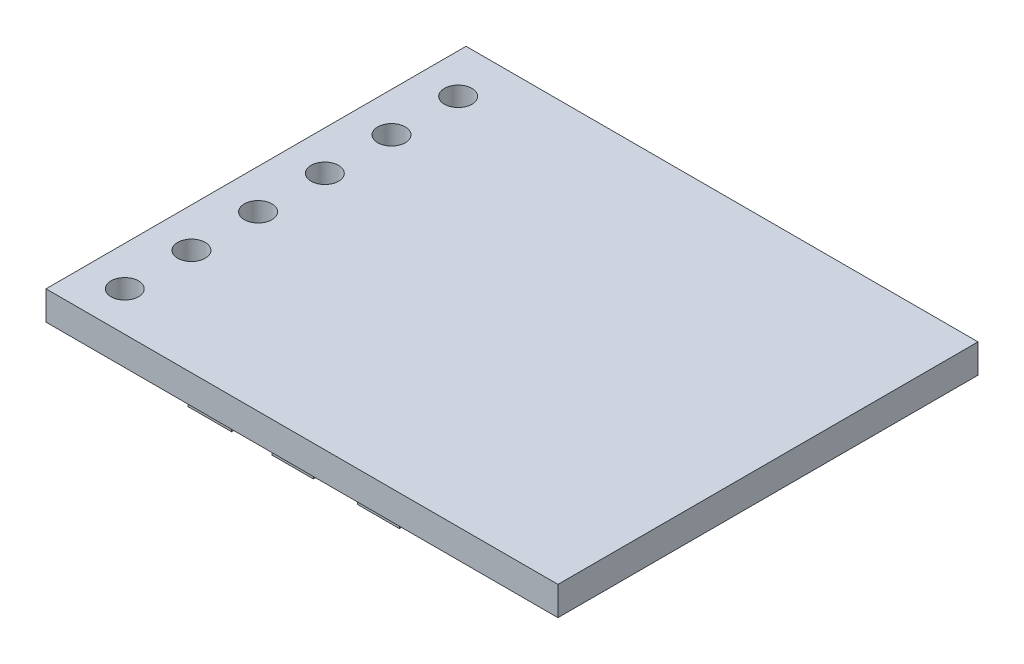
from build123d import *

# Parameters (mm, degrees)
SKETCH1_W               = 19.5
SKETCH1_H               = 16
PCB_DEPTH               = 1.1
HOLES_REACH             = 14.66
SKETCH2_R               = 0.525
SKETCH3_W               = 6.970626183
SKETCH3_H               = 7.047226471
SKETCH3_W_2             = 3.232532143
SKETCH3_H_2             = 1.853726963
SKETCH3_W_3             = 1.608606043
SKETCH3_H_3             = 0.674082532
SKETCH3_H_4             = 0.766002877
SKETCH3_W_4             = 3.140611797
SKETCH3_H_5             = 1.470725524
SKETCH3_W_5             = 0.949843568
SKETCH3_H_6             = 1.363485122
SKETCH3_W_6             = 0.919203453
SKETCH3_W_7             = 1.593285985
SKETCH3_H_7             = 0.827283108
SKETCH3_W_8             = 1.577965927
SKETCH3_W_9             = 1.669886272
SKETCH3_W_10            = 1.041763914
SKETCH3_H_8             = 1.516685697
SKETCH3_W_11            = 0.93452351
BOTTOM_COMPONENTS_DEPTH = 1.05


with BuildPart() as part:
    # Sketch1 → PCB (new body)
    with BuildSketch(Plane(origin=(0, 0, 0), x_dir=(1, 0, 0), z_dir=(0, 1, 0))):
        Rectangle(SKETCH1_W, SKETCH1_H)
    extrude(amount=PCB_DEPTH)

    # Sketch2 → Holes (cut, up to next)
    with BuildSketch(Plane(origin=(0, 1.1, 0), x_dir=(1, 0, 0), z_dir=(0, 1, 0)), mode=Mode.PRIVATE) as holes_sk1:
        with Locations((-8.25, -6.5)):
            Circle(SKETCH2_R)
    holes_tool1 = extrude(holes_sk1.sketch, amount=-HOLES_REACH, mode=Mode.PRIVATE) & part.part
    # Sketch2 → Holes (cut, up to next)
    with BuildSketch(Plane(origin=(0, 1.1, 0), x_dir=(1, 0, 0), z_dir=(0, 1, 0)), mode=Mode.PRIVATE) as holes_sk2:
        with Locations((-8.25, -3.96)):
            Circle(SKETCH2_R)
    holes_tool2 = extrude(holes_sk2.sketch, amount=-HOLES_REACH, mode=Mode.PRIVATE) & part.part
    # Sketch2 → Holes (cut, up to next)
    with BuildSketch(Plane(origin=(0, 1.1, 0), x_dir=(1, 0, 0), z_dir=(0, 1, 0)), mode=Mode.PRIVATE) as holes_sk3:
        with Locations((-8.25, -1.42)):
            Circle(SKETCH2_R)
    holes_tool3 = extrude(holes_sk3.sketch, amount=-HOLES_REACH, mode=Mode.PRIVATE) & part.part
    # Sketch2 → Holes (cut, up to next)
    with BuildSketch(Plane(origin=(0, 1.1, 0), x_dir=(1, 0, 0), z_dir=(0, 1, 0)), mode=Mode.PRIVATE) as holes_sk4:
        with Locations((-8.25, 1.12)):
            Circle(SKETCH2_R)
    holes_tool4 = extrude(holes_sk4.sketch, amount=-HOLES_REACH, mode=Mode.PRIVATE) & part.part
    # Sketch2 → Holes (cut, up to next)
    with BuildSketch(Plane(origin=(0, 1.1, 0), x_dir=(1, 0, 0), z_dir=(0, 1, 0)), mode=Mode.PRIVATE) as holes_sk5:
        with Locations((-8.25, 3.66)):
            Circle(SKETCH2_R)
    holes_tool5 = extrude(holes_sk5.sketch, amount=-HOLES_REACH, mode=Mode.PRIVATE) & part.part
    # Sketch2 → Holes (cut, up to next)
    with BuildSketch(Plane(origin=(0, 1.1, 0), x_dir=(1, 0, 0), z_dir=(0, 1, 0)), mode=Mode.PRIVATE) as holes_sk6:
        with Locations((-8.25, 6.2)):
            Circle(SKETCH2_R)
    holes_tool6 = extrude(holes_sk6.sketch, amount=-HOLES_REACH, mode=Mode.PRIVATE) & part.part
    add(holes_tool1.solids().sort_by_distance((-8.25, 1.1, 6.5))[0], mode=Mode.SUBTRACT)
    add(holes_tool2.solids().sort_by_distance((-8.25, 1.1, 3.96))[0], mode=Mode.SUBTRACT)
    add(holes_tool3.solids().sort_by_distance((-8.25, 1.1, 1.42))[0], mode=Mode.SUBTRACT)
    add(holes_tool4.solids().sort_by_distance((-8.25, 1.1, -1.12))[0], mode=Mode.SUBTRACT)
    add(holes_tool5.solids().sort_by_distance((-8.25, 1.1, -3.66))[0], mode=Mode.SUBTRACT)
    add(holes_tool6.solids().sort_by_distance((-8.25, 1.1, -6.2))[0], mode=Mode.SUBTRACT)

    # Sketch3 → Bottom components (add)
    with BuildSketch(Plane.XZ):
        with Locations((0.666422503, 0.628122359)):
            Rectangle(SKETCH3_W, SKETCH3_H)
        with Locations((-4.43515666, -5.18583948)):
            Rectangle(SKETCH3_W_2, SKETCH3_H_2)
        with Locations((-1.034103885, -5.300739911)):
            Rectangle(SKETCH3_W_3, SKETCH3_H_3)
        with Locations((-1.034103885, -6.265903537)):
            Rectangle(SKETCH3_W_3, SKETCH3_H_4)
        with Locations((2.382268949, -6.235263421)):
            Rectangle(SKETCH3_W_4, SKETCH3_H_5)
        with Locations((4.948378587, 5.967162414)):
            Rectangle(SKETCH3_W_5, SKETCH3_H_6)
        with Locations((6.265903537, 5.967162414)):
            Rectangle(SKETCH3_W_6, SKETCH3_H_6)
        with Locations((1.945647309, 6.61826486)):
            Rectangle(SKETCH3_W_7, SKETCH3_H_7)
        with Locations((-1.325184978, 6.61826486)):
            Rectangle(SKETCH3_W_8, SKETCH3_H_7)
        with Locations((-4.481116832, 6.61826486)):
            Rectangle(SKETCH3_W_9, SKETCH3_H_7)
        with Locations((4.99433876, -5.722041494)):
            Rectangle(SKETCH3_W_10, SKETCH3_H_8)
        with Locations((6.411444083, -5.722041494)):
            Rectangle(SKETCH3_W_11, SKETCH3_H_8)
    extrude(amount=BOTTOM_COMPONENTS_DEPTH)


solid = part.part
